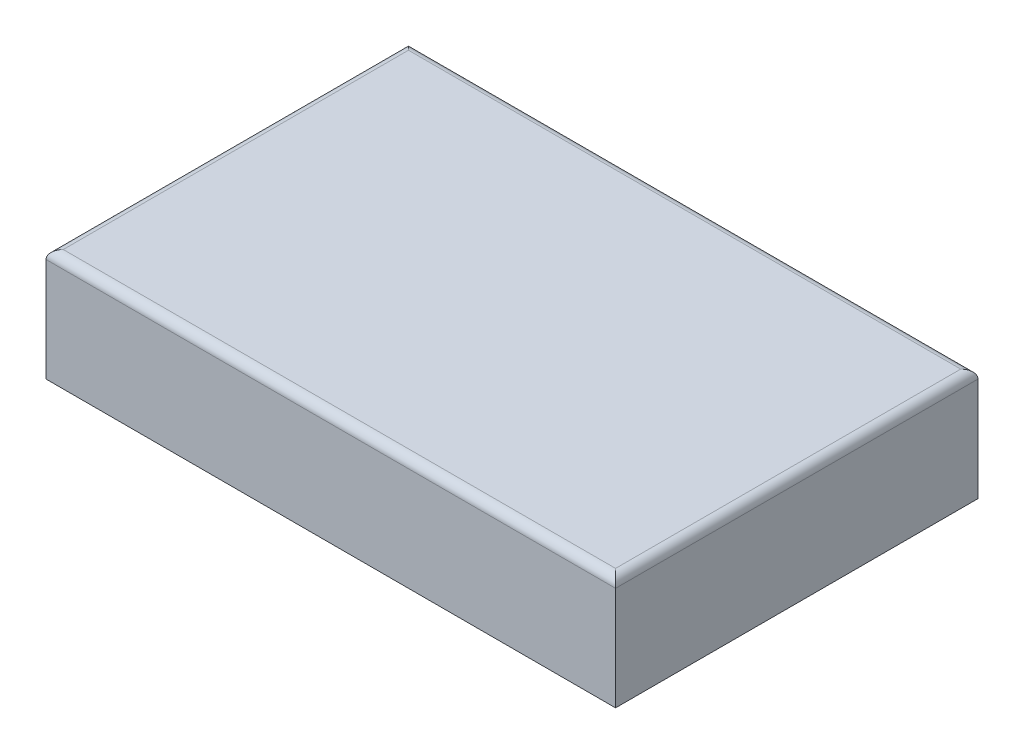
from build123d import *

# Parameters (mm, degrees)
SKETCH1_W           = 66
SKETCH1_H           = 42
SKETCH1_W_2         = 60
SKETCH1_H_2         = 36
BOSS_EXTRUDE1_DEPTH = 10
SKETCH3_W           = 66
SKETCH3_H           = 42
BOSS_EXTRUDE3_DEPTH = 3
FILLET2_R           = 1


with BuildPart() as part:
    # Sketch1 → Boss-Extrude1 (new body)
    with BuildSketch(Plane(origin=(0, 0, 0), x_dir=(1, 0, 0), z_dir=(0, 1, 0))):
        Rectangle(SKETCH1_W, SKETCH1_H)
        Rectangle(SKETCH1_W_2, SKETCH1_H_2, mode=Mode.SUBTRACT)
    extrude(amount=BOSS_EXTRUDE1_DEPTH)

    # Sketch3 → Boss-Extrude3 (add)
    with BuildSketch(Plane(origin=(0, 10, 0), x_dir=(1, 0, 0), z_dir=(0, 1, 0))):
        Rectangle(SKETCH3_W, SKETCH3_H)
    extrude(amount=BOSS_EXTRUDE3_DEPTH)

    # Fillet2
    fillet2_edges = [part.edges().sort_by_distance(p)[0] for p in [
        (0, 13, -21),
        (33, 13, 0),
        (0, 13, 21),
        (-33, 13, 0),
    ]]
    fillet(fillet2_edges, radius=FILLET2_R)


solid = part.part
